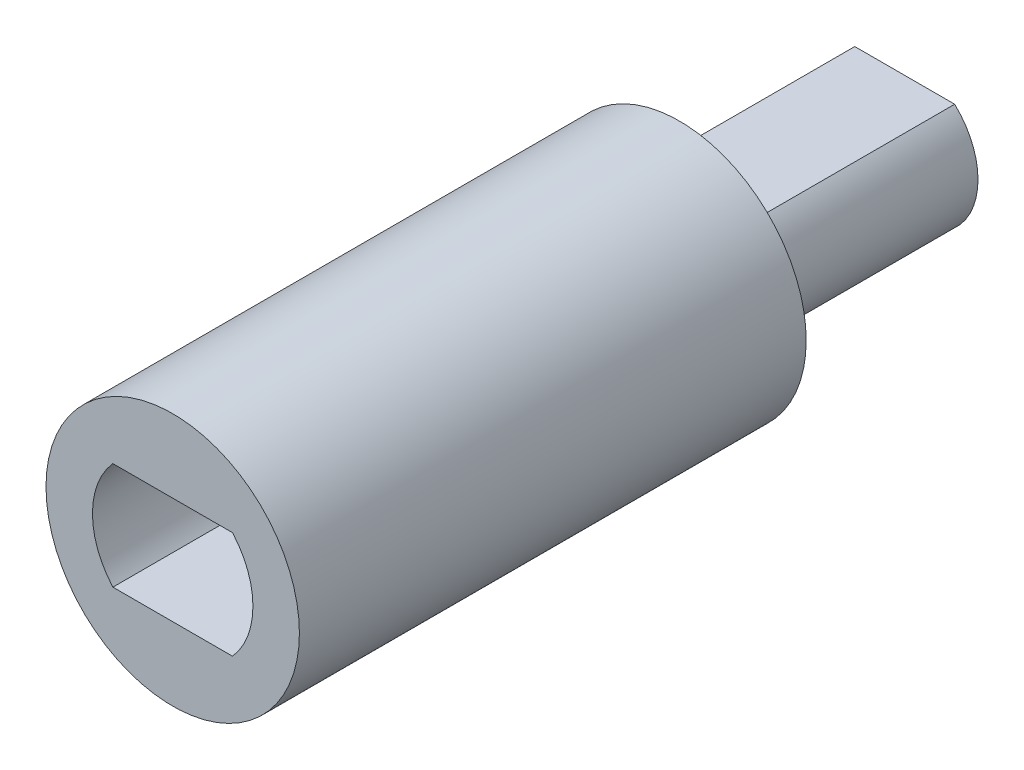
from build123d import *

# Parameters (mm, degrees)
SKETCH13_R           = 4.5
BOSS_EXTRUDE13_DEPTH = 18
BOSS_EXTRUDE16_DEPTH = 8
CUT_EXTRUDE4_DEPTH   = 8


with BuildPart() as part:
    # Sketch13 → Boss-Extrude13 (new body)
    with BuildSketch(Plane.XY):
        Circle(SKETCH13_R)
    extrude(amount=BOSS_EXTRUDE13_DEPTH)

    # Sketch16 → Boss-Extrude16 (add)
    with BuildSketch(Plane.XY):
        with BuildLine():
            Line((1.77434864, 1.903610178), (-1.77434864, 1.903610178))
            ThreePointArc((-1.77434864, 1.903610178), (-2.598346475, 0.143667672), (-1.973399699, -1.696389822))
            Line((-1.973399699, -1.696389822), (1.973399699, -1.696389822))
            ThreePointArc((1.973399699, -1.696389822), (2.598346475, 0.143667672), (1.77434864, 1.903610178))
        make_face()
    extrude(amount=-BOSS_EXTRUDE16_DEPTH)

    # Sketch17 → Cut-Extrude4 (cut)
    with BuildSketch(Plane.XY.offset(18)):
        with BuildLine():
            ThreePointArc((-2.124264579, 1.9), (-2.85, 0), (-2.124264579, -1.9))
            Line((-2.124264579, -1.9), (2.124264579, -1.9))
            ThreePointArc((2.124264579, -1.9), (2.85, 0), (2.124264579, 1.9))
            Line((2.124264579, 1.9), (-2.124264579, 1.9))
        make_face()
    extrude(amount=-CUT_EXTRUDE4_DEPTH, mode=Mode.SUBTRACT)


solid = part.part
